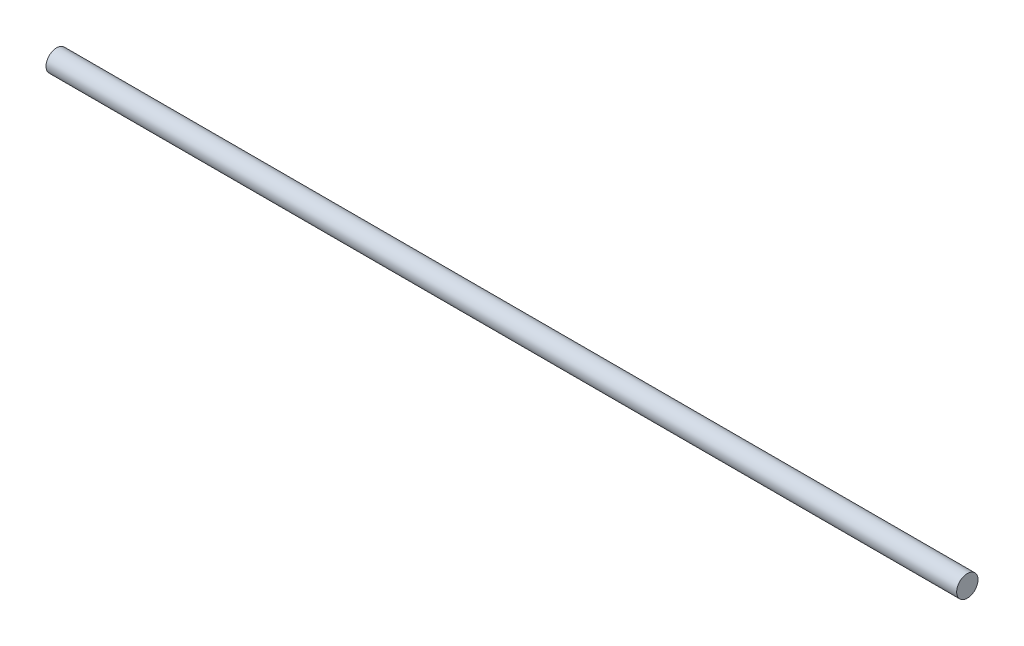
from build123d import *

# Parameters (mm, degrees)
SKETCH4_R           = 3.81
BOSS_EXTRUDE2_DEPTH = 324.612


with BuildPart() as part:
    # Sketch4 → Boss-Extrude2 (new body)
    with BuildSketch(Plane(origin=(0, 0, 0), x_dir=(0, 0, -1), z_dir=(1, 0, 0))):
        with Locations((57.673059582, 144.175869708)):
            Circle(SKETCH4_R)
    extrude(amount=BOSS_EXTRUDE2_DEPTH)


solid = part.part
